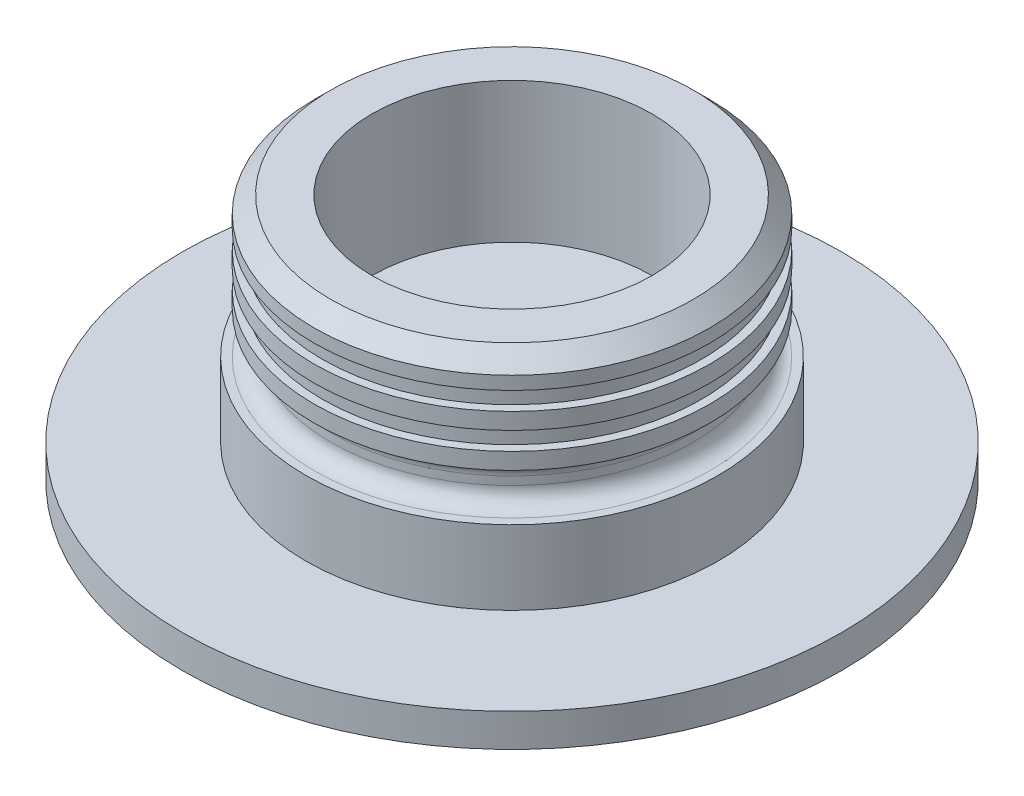
from build123d import *

# Parameters (mm, degrees)
SKETCH1_R           = 40
SKETCH1_R_2         = 2.1
BOSS_EXTRUDE1_DEPTH = 4
SKETCH2_R           = 25
SKETCH2_R_2         = 6.1
BOSS_EXTRUDE5_DEPTH = 9
SKETCH6_R           = 22
SKETCH6_R_2         = 17
BOSS_EXTRUDE6_DEPTH = 5
SKETCH7_R           = 24
SKETCH7_R_2         = 17
BOSS_EXTRUDE7_DEPTH = 12
SKETCH9_W           = 1
SKETCH9_H           = 2.2
CHAMFER1_SIZE       = 2
FILLET1_R           = 2


with BuildPart() as part:
    # Sketch1 → Boss-Extrude1 (new body)
    with BuildSketch(Plane(origin=(0, 0, 0), x_dir=(1, 0, 0), z_dir=(0, 1, 0))):
        with Locations(Location((0, 0, 0), (0, 0, 270))):
            Circle(SKETCH1_R)
        with Locations(Location((0, 0, 0), (0, 0, 270))):
            Circle(SKETCH1_R_2, mode=Mode.SUBTRACT)
    extrude(amount=BOSS_EXTRUDE1_DEPTH)

    # Sketch2 → Boss-Extrude5 (add)
    with BuildSketch(Plane(origin=(0, 4, 0), x_dir=(1, 0, 0), z_dir=(0, 1, 0))):
        with Locations(Location((0, 0, 0), (0, 0, 270))):
            Circle(SKETCH2_R)
        with Locations(Location((0, 0, 0), (0, 0, 270))):
            Circle(SKETCH2_R_2, mode=Mode.SUBTRACT)
    extrude(amount=BOSS_EXTRUDE5_DEPTH)

    # Sketch6 → Boss-Extrude6 (add)
    with BuildSketch(Plane(origin=(0, 13, 0), x_dir=(1, 0, 0), z_dir=(0, 1, 0))):
        with Locations(Location((0, 0, 0), (0, 0, 270))):
            Circle(SKETCH6_R)
        with Locations(Location((0, 0, 0), (0, 0, 270))):
            Circle(SKETCH6_R_2, mode=Mode.SUBTRACT)
    extrude(amount=BOSS_EXTRUDE6_DEPTH)

    # Sketch7 → Boss-Extrude7 (add)
    with BuildSketch(Plane(origin=(0, 18, 0), x_dir=(1, 0, 0), z_dir=(0, 1, 0))):
        with Locations(Location((0, 0, 0), (0, 0, 270))):
            Circle(SKETCH7_R)
        with Locations(Location((0, 0, 0), (0, 0, 270))):
            Circle(SKETCH7_R_2, mode=Mode.SUBTRACT)
    extrude(amount=BOSS_EXTRUDE7_DEPTH)

    # Sketch9 → Cut-Revolve1 (revolve, cut)
    with BuildSketch(Plane(origin=(0, 0, 0), x_dir=(0, 0, -1), z_dir=(1, 0, 0)), mode=Mode.PRIVATE) as cut_revolve1_sk:
        with Locations((-23.5, 25.3)):
            Rectangle(SKETCH9_W, SKETCH9_H)
        with Locations((-23.5, 21.1)):
            Rectangle(SKETCH9_W, SKETCH9_H)
    revolve(cut_revolve1_sk.sketch.rotate(Axis((0, 0, 0), (0, 1, 0)), 180), axis=Axis((0, 0, 0), (0, 1, 0)), mode=Mode.SUBTRACT)

    # Chamfer1
    chamfer1_edges = [part.edges().sort_by_distance(p)[0] for p in [
        (0, 30, -24),
    ]]
    chamfer(chamfer1_edges, length=CHAMFER1_SIZE)

    # Fillet1
    fillet1_edges = [part.edges().sort_by_distance(p)[0] for p in [
        (0, 18, -22),
        (0, 13, -22),
    ]]
    fillet(fillet1_edges, radius=FILLET1_R - 0.0001)  # a hair under: the kernel refuses the full size


solid = part.part
